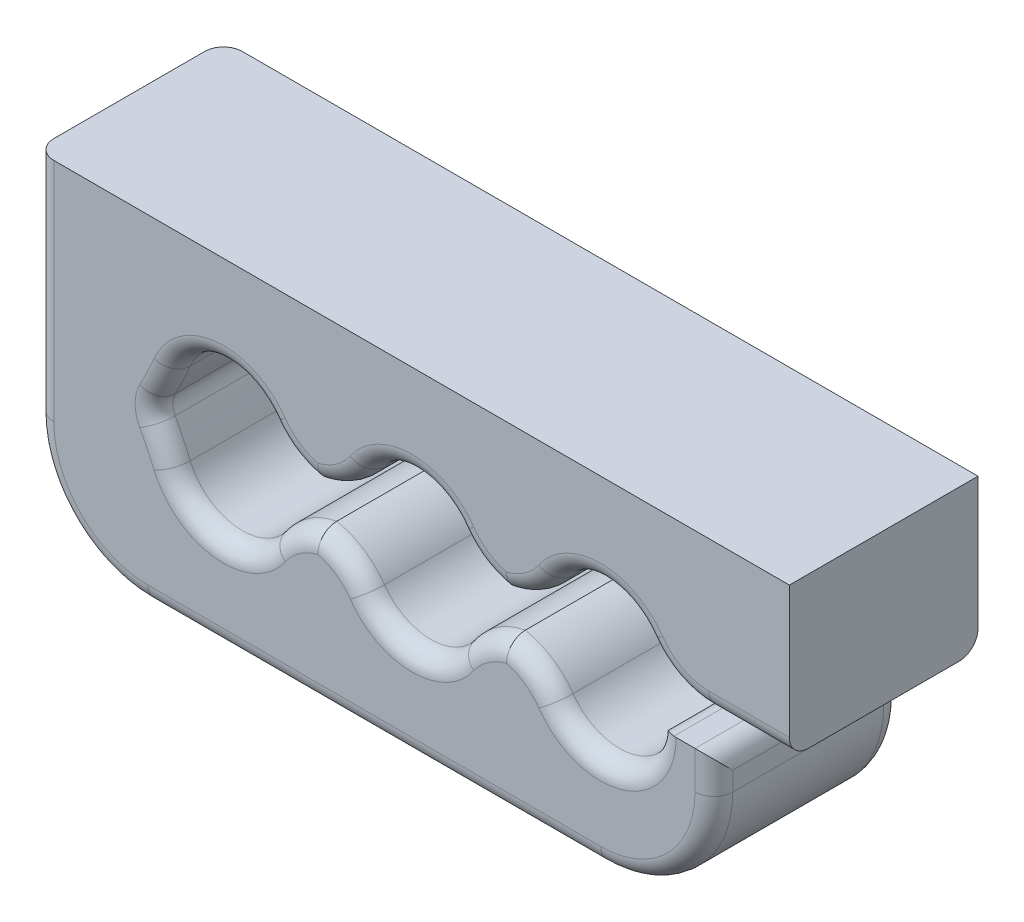
from build123d import *

# Parameters (mm, degrees)
BOSS_EXTRUDE1_DEPTH = 2.5
FILLET1_R           = 10
FILLET2_R           = 2
FILLET3_R           = 3
FILLET4_R           = 0.5


with BuildPart() as part:
    # Sketch3 → Boss-Extrude1 (new, symmetric)
    with BuildSketch(Plane.XY):
        with BuildLine():
            Line((-20, 0), (-20, -4))
            Line((-20, -4), (-2, -4))
            Line((-2, -4), (-2, 0))
            Line((-2, 0), (-3.5, 0))
            ThreePointArc((-3.5, 0), (-5, -1.5), (-6.5, 0))
            Line((-6.5, 0), (-8.5, 0))
            ThreePointArc((-8.5, 0), (-10, -1.5), (-11.5, 0))
            Line((-11.5, 0), (-13.5, 0))
            ThreePointArc((-13.5, 0), (-15, -1.5), (-16.5, 0))
            ThreePointArc((-16.5, 0), (-16.844061217, 0.5), (-16.5, 1))
            ThreePointArc((-16.5, 1), (-15, 2.5), (-13.5, 1))
            Line((-13.5, 1), (-11.5, 1))
            ThreePointArc((-11.5, 1), (-10, 2.5), (-8.5, 1))
            Line((-8.5, 1), (-6.5, 1))
            ThreePointArc((-6.5, 1), (-5, 2.5), (-3.5, 1))
            Line((-3.5, 1), (-2, 1))
            Line((-2, 1), (0, 1))
            Line((0, 1), (0, 5))
            Line((0, 5), (-2, 5))
            Line((-2, 5), (-20, 5))
            Line((-20, 5), (-20, 1))
            Line((-20, 1), (-20, 0))
        make_face()
    extrude(amount=BOSS_EXTRUDE1_DEPTH, both=True)

    # Fillet1
    fillet1_edges = [part.edges().sort_by_distance(p)[0] for p in [
        (-16.5, 1, 0),
        (-16.5, 0, 0),
    ]]
    fillet(fillet1_edges, radius=FILLET1_R)

    # Fillet2
    # the kernel refuses this fillet: 2 mm, written as the material it takes off along each edge
    with BuildSketch(Plane(origin=(-13.5, 1, -5.930703308), x_dir=(-0.29945633517394393, 0.9541100058820212, 0), z_dir=(0, 0, 1))) as fillet2_piece_1:
        with BuildLine():
            CenterArc((1.497281676, -1.908220012), FILLET2_R, 107.42495229, 55.150095421)
            Line((-0.410938336, -1.309307341), (0, 0))
            ThreePointArc((0, 0), (0.449184503, -0.068834991), (0.898369006, 0))
        make_face()
    extrude(amount=11.861406616, mode=Mode.SUBTRACT)
    with BuildSketch(Plane(origin=(-11.5, 1, -5.930703308), x_dir=(-1, 0, 0), z_dir=(0, 0, 1))) as fillet2_piece_2:
        with BuildLine():
            CenterArc((1.372281323, -2), FILLET2_R, 90, 55.150095421)
            ThreePointArc((-0.26902229, -0.857142857), (-0.068834991, -0.449184503), (0, 0))
            Line((0, 0), (1.372281323, 0))
        make_face()
    extrude(amount=11.861406616, mode=Mode.SUBTRACT)
    with BuildSketch(Plane(origin=(-8.5, 1, 5.930703308), x_dir=(-0.29945633517396103, 0.9541100058820159, 0), z_dir=(0, 0, -1)), Plane(origin=(-3.5, 1, 5.930703308), x_dir=(-0.2994563351739779, 0.9541100058820106, 0), z_dir=(0, 0, -1)), Plane(origin=(-8.5, 0, -5.930703308), x_dir=(-0.29945633517396103, -0.9541100058820159, 0), z_dir=(0, 0, 1)), Plane(origin=(-13.5, 0, -5.930703308), x_dir=(-0.2994563351739456, -0.9541100058820208, 0), z_dir=(0, 0, 1))) as fillet2_piece_3:
        with BuildLine():
            CenterArc((1.497281676, 1.908220012), FILLET2_R, 197.42495229, 55.150095421)
            Line((-0.410938336, 1.309307341), (0, 0))
            ThreePointArc((0, 0), (0.449184503, 0.068834991), (0.898369006, 0))
        make_face()
    extrude(amount=11.861406616, mode=Mode.SUBTRACT)
    with BuildSketch(Plane(origin=(-6.5, 1, 5.930703308), x_dir=(-1, 0, 0), z_dir=(0, 0, -1)), Plane(origin=(-6.5, 0, -5.930703308), x_dir=(-1, 0, 0), z_dir=(0, 0, 1)), Plane(origin=(-11.5, 0, -5.930703308), x_dir=(-1, 0, 0), z_dir=(0, 0, 1))) as fillet2_piece_4:
        with BuildLine():
            CenterArc((1.372281323, 2), FILLET2_R, 214.849904579, 55.150095421)
            ThreePointArc((-0.26902229, 0.857142857), (-0.068834991, 0.449184503), (0, 0))
            Line((0, 0), (1.372281323, 0))
        make_face()
    extrude(amount=11.861406616, mode=Mode.SUBTRACT)

    # Fillet3
    fillet3_edges = [part.edges().sort_by_distance(p)[0] for p in [
        (-2, -4, 0),
        (-20, -4, 0),
    ]]
    fillet(fillet3_edges, radius=FILLET3_R)

    # Fillet4
    fillet4_edges = [part.edges().sort_by_distance(p)[0] for p in [
        (-2, -0.5, -2.5),
        (-2, -0.5, 2.5),
        (-11, -4, -2.5),
        (-19.121320344, -3.121320344, -2.5),
        (-2.878679656, -3.121320344, -2.5),
        (-11, -4, 2.5),
        (-19.121320344, -3.121320344, 2.5),
        (-2.878679656, -3.121320344, 2.5),
        (-20, 2, -2.5),
        (-4.550815497, -1.431165009, 2.5),
        (-4.550815497, -1.431165009, -2.5),
        (-3.5, 0, 0),
        (-2, 0, 0),
        (-20, 2, 2.5),
        (-15.155006773, 2.49196947, -2.5),
        (-15.155006773, 2.49196947, 2.5),
        (-16.844061217, 0.5, -2.5),
        (-16.570926413, -0.165089198, -2.5),
        (-16.570926413, 1.165089198, -2.5),
        (-16.844061217, 0.5, 2.5),
        (-16.570926413, -0.165089198, 2.5),
        (-16.570926413, 1.165089198, 2.5),
        (-15.155006773, -1.49196947, -2.5),
        (-10, -1.5, -2.5),
        (-1.063859338, 1, -2.5),
        (-5, 2.5, -2.5),
        (-10, 2.5, -2.5),
        (-13.215206511, -0.321497629, -2.5),
        (-11.784793489, -0.321497629, -2.5),
        (-8.215206511, -0.321497629, -2.5),
        (-6.784793489, -0.321497629, -2.5),
        (-3.053538777, 1.227189479, -2.5),
        (-6.784793489, 1.321497629, -2.5),
        (-8.215206511, 1.321497629, -2.5),
        (-11.784793489, 1.321497629, -2.5),
        (-13.215206511, 1.321497629, -2.5),
        (-10, 2.5, 2.5),
        (-5, 2.5, 2.5),
        (-1.063859338, 1, 2.5),
        (-10, -1.5, 2.5),
        (-15.155006773, -1.49196947, 2.5),
        (-13.215206511, -0.321497629, 2.5),
        (-11.784793489, -0.321497629, 2.5),
        (-8.215206511, -0.321497629, 2.5),
        (-6.784793489, -0.321497629, 2.5),
        (-3.053538777, 1.227189479, 2.5),
        (-6.784793489, 1.321497629, 2.5),
        (-8.215206511, 1.321497629, 2.5),
        (-11.784793489, 1.321497629, 2.5),
        (-13.215206511, 1.321497629, 2.5),
    ]]
    fillet(fillet4_edges, radius=FILLET4_R)


solid = part.part
